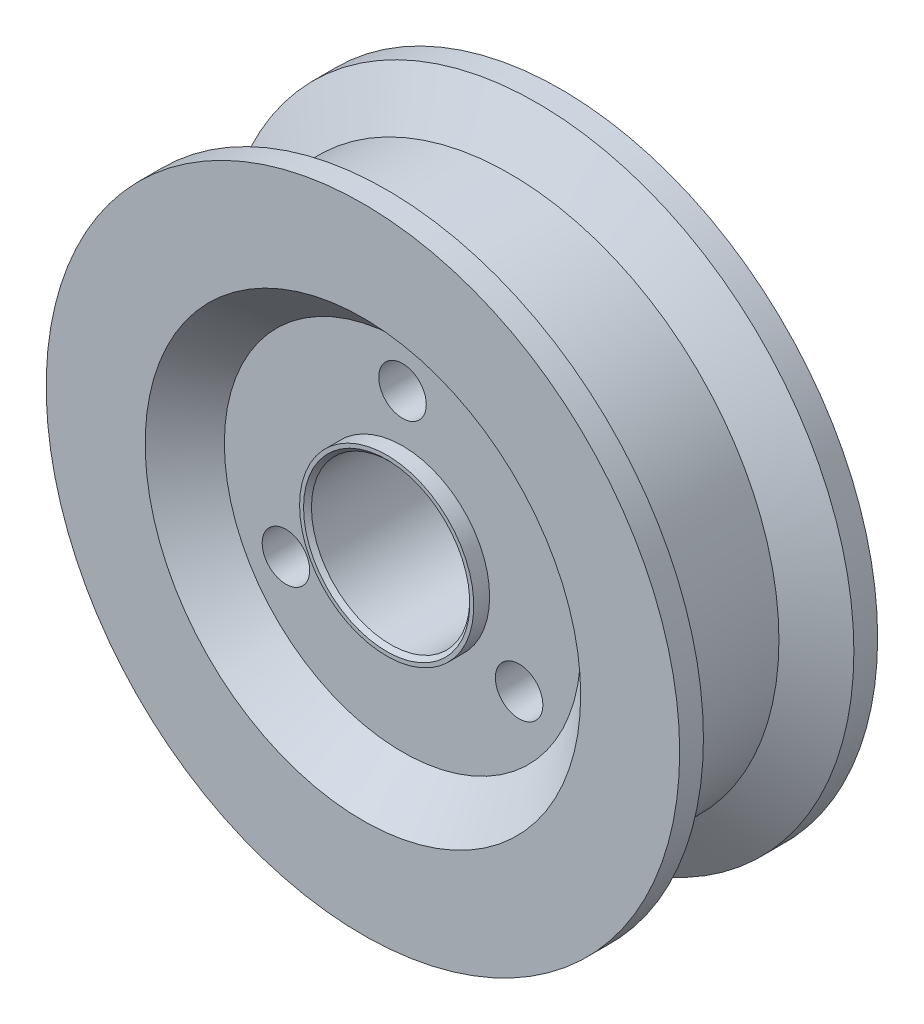
from build123d import *

# Parameters (mm, degrees)
ESQUISSE1_R             = 40
ESQUISSE1_R_2           = 10
BOSS_EXTRU_1_DEPTH      = 12.5
ESQUISSE2_R             = 22.5
ENL_V_MAT_EXTRU_1_DEPTH = 5
CHANFREIN1_SIZE         = 5
ESQUISSE4_R             = 3
ENL_V_MAT_EXTRU_2_DEPTH = 61
BOSS_EXTRU_2_DEPTH      = 2
BOSS_EXTRU_2_DEPTH_BACK = 17
ESQUISSE5_R             = 11
ESQUISSE5_R_2           = 10
CHANFREIN2_SIZE         = 0.5
ESCALA1_SCALE           = 0.7916


with BuildPart() as part:
    # Esquisse1 → Boss.-Extru.1 (new, symmetric)
    with BuildSketch(Plane.XY):
        Circle(ESQUISSE1_R)
        Circle(ESQUISSE1_R_2, mode=Mode.SUBTRACT)
    extrude(amount=BOSS_EXTRU_1_DEPTH, both=True)

    # Esquisse2 → Enlèv. mat.-Extru.1 (cut)
    with BuildSketch(Plane.XY.offset(12.5)):
        Circle(ESQUISSE2_R)
    enl_v_mat_extru_1 = extrude(amount=-ENL_V_MAT_EXTRU_1_DEPTH, mode=Mode.SUBTRACT)

    # Symétrie1: Enlèv. mat.-Extru.1 across plane
    add(enl_v_mat_extru_1.mirror(Plane.XY), mode=Mode.SUBTRACT)

    # Esquisse3 → Enlèvement de matière-Révolution1 (revolve, cut)
    with BuildSketch(Plane(origin=(0, 0, 0), x_dir=(1, 0, 0), z_dir=(0, 1, 0))):
        Polygon((40, 9.5), (34, 6.035898385), (34, -6.035898385), (40, -9.5), align=None)
    revolve(axis=Axis((0, 0, 0), (0, 0, -1)), mode=Mode.SUBTRACT)

    # Chanfrein1
    chanfrein1_edges = [part.edges().sort_by_distance(p)[0] for p in [
        (-22.5, 0, 12.5),
        (-22.5, 0, -12.5),
    ]]
    chamfer(chanfrein1_edges, length=CHANFREIN1_SIZE - 0.0001)  # a hair under: the kernel refuses the full size

    # Esquisse4 → Enlèv. mat.-Extru.2 (cut, through all)
    with BuildSketch(Plane(origin=(0, 0, -7.5), x_dir=(-1, 0, 0), z_dir=(0, 0, -1))):
        with Locations((0, 17)):
            Circle(ESQUISSE4_R)
        with Locations((14.722431864, -8.5)):
            Circle(ESQUISSE4_R)
        with Locations((-14.722431864, -8.5)):
            Circle(ESQUISSE4_R)
    extrude(amount=-ENL_V_MAT_EXTRU_2_DEPTH, mode=Mode.SUBTRACT)

    # Esquisse5 → Boss.-Extru.2 (add, two sides: drawn at the far end of the back side and taken through both)
    with BuildSketch(Plane(origin=(0, 0, -7.5), x_dir=(-1, 0, 0), z_dir=(0, 0, -1)).offset(-BOSS_EXTRU_2_DEPTH_BACK)):
        Circle(ESQUISSE5_R)
        Circle(ESQUISSE5_R_2, mode=Mode.SUBTRACT)
    extrude(amount=BOSS_EXTRU_2_DEPTH + BOSS_EXTRU_2_DEPTH_BACK)

    # Chanfrein2
    chanfrein2_edges = [part.edges().sort_by_distance(p)[0] for p in [
        (10, 0, 9.5),
        (10, 0, -9.5),
    ]]
    chamfer(chanfrein2_edges, length=CHANFREIN2_SIZE)


with BuildPart() as part_1:
    # Escala1: scaled about (0, 0, 0)
    add(part.part.scale(ESCALA1_SCALE))


solid = part_1.part
